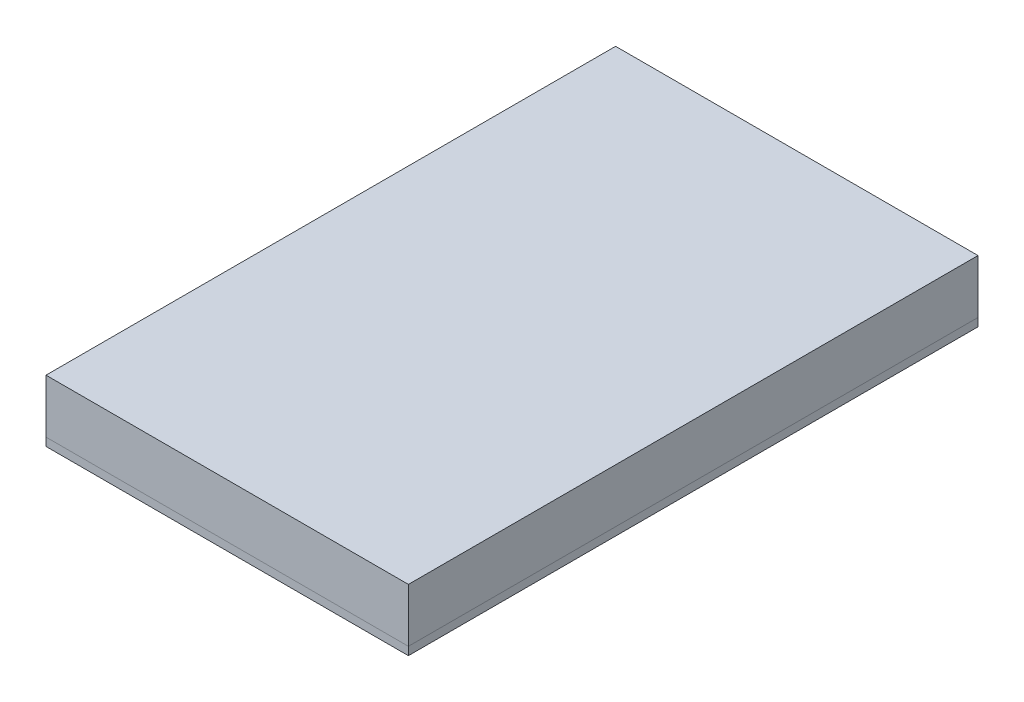
from build123d import *

# Parameters (mm, degrees)
SKETCH1_W           = 44.6
SKETCH1_H           = 70.1
BOSS_EXTRUDE1_DEPTH = 5
SKETCH2_W           = 44.6
SKETCH2_H           = 70.1
BOSS_EXTRUDE2_DEPTH = 1
SKETCH3_W           = 44.6
SKETCH3_H           = 70.1
BOSS_EXTRUDE3_DEPTH = 1.6
SKETCH4_W           = 44.6
SKETCH4_H           = 70.1
SKETCH4_W_2         = 3.6
SKETCH4_H_2         = 3.6
BOSS_EXTRUDE4_DEPTH = 1


with BuildPart() as part:
    # Sketch1 → Boss-Extrude1 (new body)
    with BuildSketch(Plane(origin=(0, 0, 0), x_dir=(1, 0, 0), z_dir=(0, 1, 0))):
        with Locations((0, 0.5)):
            Rectangle(SKETCH1_W, SKETCH1_H)
        Polygon((15.8, 28.05), (15.8, -28.05), (-15.8, -28.05), (-15.8, 28.05), (-6.8, 28.05), (-6.8, 33.85), (6.8, 33.85), (6.8, 28.05), align=None, mode=Mode.SUBTRACT)
    extrude(amount=BOSS_EXTRUDE1_DEPTH)

    # Sketch2 → Boss-Extrude2 (add)
    with BuildSketch(Plane(origin=(0, 5, 0), x_dir=(1, 0, 0), z_dir=(0, 1, 0))):
        with Locations((0, 0.5)):
            Rectangle(SKETCH2_W, SKETCH2_H)
    extrude(amount=-BOSS_EXTRUDE2_DEPTH)

    # Sketch3 → Boss-Extrude3 (add)
    with BuildSketch(Plane.XZ):
        with Locations((0, -0.5)):
            Rectangle(SKETCH3_W, SKETCH3_H)
        Polygon((-6.8, -29.55), (-17.3, -29.55), (-17.3, 29.55), (17.3, 29.55), (17.3, -29.55), (6.8, -29.55), (6.8, -33.85), (-6.8, -33.85), align=None, mode=Mode.SUBTRACT)
    extrude(amount=BOSS_EXTRUDE3_DEPTH)


with BuildPart() as body_2:
    # Sketch4 → Boss-Extrude4 (new body)
    with BuildSketch(Plane.XZ.offset(1.6)):
        with Locations((0, -0.5)):
            Rectangle(SKETCH4_W, SKETCH4_H)
        with Locations((0, 5.55)):
            Rectangle(SKETCH4_W_2, SKETCH4_H_2, mode=Mode.SUBTRACT)
        with Locations((0, -4.45)):
            Rectangle(SKETCH4_W_2, SKETCH4_H_2, mode=Mode.SUBTRACT)
        with Locations((0, -14.45)):
            Rectangle(SKETCH4_W_2, SKETCH4_H_2, mode=Mode.SUBTRACT)
    extrude(amount=BOSS_EXTRUDE4_DEPTH)


solid = Compound([part.part, body_2.part])
